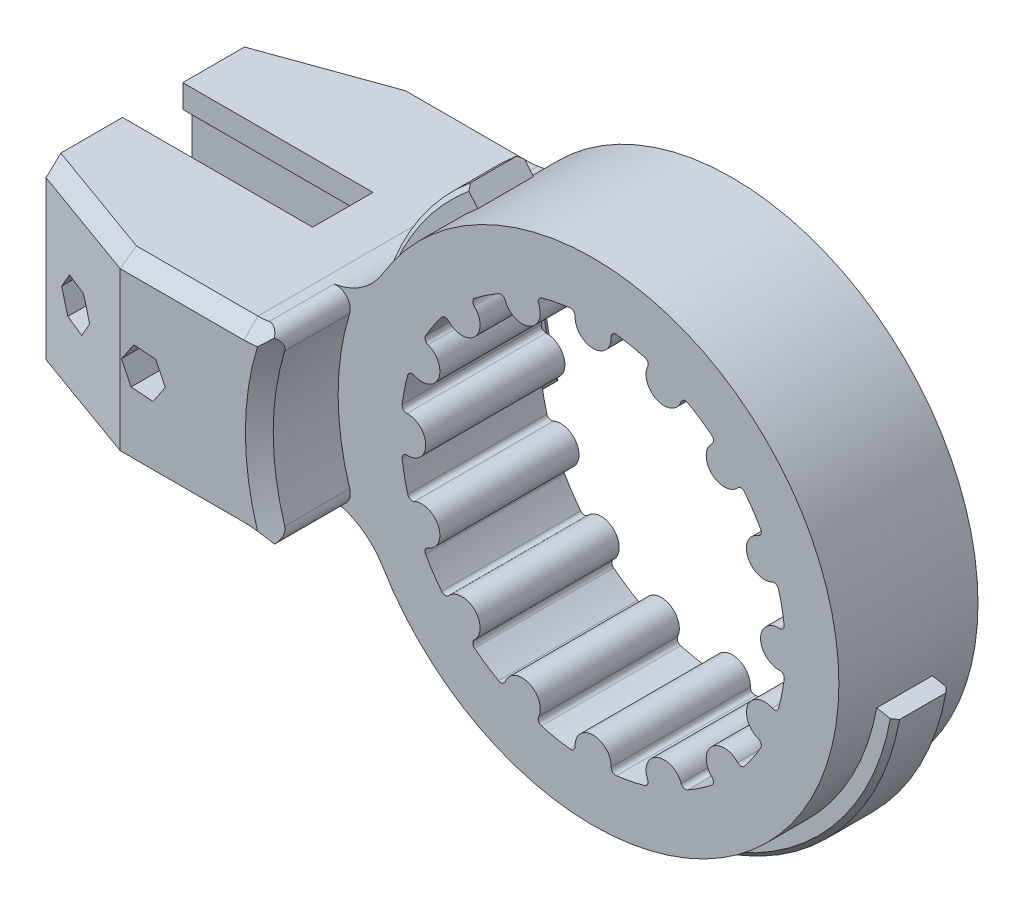
from build123d import *

# Parameters (mm, degrees)
SKETCH1_R           = 53
BOSS_EXTRUDE1_DEPTH = 30
BOSS_EXTRUDE2_DEPTH = 30
BOSS_EXTRUDE3_DEPTH = 17
BOSS_EXTRUDE4_START = 17
BOSS_EXTRUDE4_DEPTH = 17
SKETCH7_W           = 82
SKETCH7_H           = 12.999999999999998
CUT_EXTRUDE3_DEPTH  = 141.13564856952
CUT_EXTRUDE4_DEPTH  = 141.13564856952
FILLET3_R           = 15
CUT_EXTRUDE5_DEPTH  = 41
SKETCH11_R          = 2.750000000000008
CUT_EXTRUDE6_DEPTH  = 138.85862323409444
SKETCH12_R          = 4.599999999999999
SKETCH12_R_2        = 4.600000000000013
CUT_EXTRUDE7_DEPTH  = 12
CUT_EXTRUDE8_DEPTH  = 12
CHAMFER1_SIZE       = 3
CHAMFER2_SIZE       = 3
FILLET5_R           = 3
SKETCH25_R          = 57.000000000000014
SKETCH25_R_2        = 53.00000000000001
BOSS_EXTRUDE8_DEPTH = 6
CUT_EXTRUDE12_START = -15
CUT_EXTRUDE12_DEPTH = 15
CHAMFER4_SIZE       = 1
CUT_EXTRUDE13_DEPTH = 133.5066036875144
FILLET6_R           = 1


with BuildPart() as part:
    # Sketch1 → Boss-Extrude1 (new body)
    with BuildSketch(Plane.XY):
        Circle(SKETCH1_R)
    extrude(amount=BOSS_EXTRUDE1_DEPTH)

    # Sketch4 → Boss-Extrude2 (add)
    with BuildSketch(Plane(origin=(0, 0, 0), x_dir=(-1, 0, 0), z_dir=(0, 0, -1))):
        with BuildLine():
            Line((49.081564767232116, -19.999999999999993), (110, -19.999999999999993))
            Line((110, -19.999999999999993), (110, 20.000000000000007))
            Line((110, 20.000000000000007), (49.08156476723211, 20.000000000000007))
            ThreePointArc((49.08156476723211, 20.000000000000007), (53.00000000000001, 8.83e-15), (49.081564767232116, -19.999999999999993))
        make_face()
    extrude(amount=-BOSS_EXTRUDE2_DEPTH)

    # Sketch5 → Boss-Extrude3 (add)
    with BuildSketch(Plane(origin=(0, 0, 0), x_dir=(-1, 0, 0), z_dir=(0, 0, -1))):
        with BuildLine():
            Line((110, -20), (110, 20))
            Line((110, 20), (51.234753829797995, 20))
            ThreePointArc((51.234753829797995, 20), (55, 0), (51.234753829797995, -20))
            Line((51.234753829797995, -20), (110, -20))
        make_face()
    extrude(amount=BOSS_EXTRUDE3_DEPTH)

    # Sketch6 → Boss-Extrude4 (add)
    with BuildSketch(Plane.XY.offset(30).offset(BOSS_EXTRUDE4_START)):
        with BuildLine():
            Line((-110, -20), (-51.234753829797995, -20))
            ThreePointArc((-51.234753829797995, -20), (-54.99999999999999, 6.74e-15), (-51.23475382979798, 20.00000000000001))
            Line((-51.23475382979798, 20.00000000000001), (-110.00000000000001, 20))
            Line((-110.00000000000001, 20), (-110, -20))
        make_face()
    extrude(amount=-BOSS_EXTRUDE4_DEPTH)

    # Sketch7 → Cut-Extrude3 (cut, through all)
    with BuildSketch(Plane(origin=(0, 20.000000000000007, 0), x_dir=(1, -1.3e-16, 0), z_dir=(1.3e-16, 1, 0))):
        with Locations((-110, -15)):
            Rectangle(SKETCH7_W, SKETCH7_H)
    extrude(amount=-CUT_EXTRUDE3_DEPTH, mode=Mode.SUBTRACT)

    # Sketch8 → Cut-Extrude4 (cut, through all)
    with BuildSketch(Plane(origin=(0, 20.000000000000007, 0), x_dir=(1, -1.3e-16, 0), z_dir=(1.3e-16, 1, 0))):
        Polygon((-110, 7.999999999999993), (-84.99999999999999, 16.999999999999996), (-110, 17), align=None)
        Polygon((-110.00000000000001, -38), (-85.00000000000001, -47), (-110.00000000000001, -47), align=None)
    extrude(amount=-CUT_EXTRUDE4_DEPTH, mode=Mode.SUBTRACT)

    # Fillet3
    # the kernel refuses this fillet: 15 mm, written as the material it adds along each edge
    with BuildSketch(Plane(origin=(-49.0815647672321, 20.000000000000014, -23.048446553404), x_dir=(0.4473529357802653, 0.8943575072915626, 0), z_dir=(0, 0, 1))) as fillet3_piece_1_section:
        with BuildLine():
            CenterArc((9.291046517037513, 14.955714519282), FILLET3_R, 206.57397747208606, 59.02220221936807)
            Line((-4.1243160923359525, 8.245420482578071), (0, 0))
            ThreePointArc((0, 0), (4.0696319454792445, 0.15647536520358749), (8.139263890958485, 1e-16))
        make_face()
    fillet3_piece_1 = extrude(amount=53.048446553404, mode=Mode.PRIVATE)
    fillet3_piece_1 = split(fillet3_piece_1, bisect_by=Plane(origin=(-53.28116974823122, 20.422092874134577, 0), z_dir=(0, 0, -1)), keep=Keep.TOP, mode=Mode.PRIVATE)
    fillet3_piece_1 = split(fillet3_piece_1, bisect_by=Plane(origin=(-53.28116974823122, 20.422092874134577, -17), z_dir=(0, 0, 1)), keep=Keep.TOP, mode=Mode.PRIVATE)
    fillet3_piece_1 = fillet3_piece_1 - Plane(origin=(-4.619e-14, -8.9e-16, -8.500000000001432), x_dir=(-0.9315409787235998, 0.36363636363636387, 0), z_dir=(0, 0, 1)) * Cylinder(54.999999999999964, 140, mode=Mode.PRIVATE)
    add(fillet3_piece_1)
    with BuildSketch(Plane(origin=(-49.0815647672321, 20.000000000000004, 0), x_dir=(0.4473529357802649, 0.8943575072915632, 0), z_dir=(0, 0, 1))) as fillet3_piece_2_section:
        with BuildLine():
            CenterArc((9.291046517037534, 14.955714519282003), FILLET3_R, 206.57397747208603, 59.02220221936807)
            Line((-4.124316092335939, 8.245420482578082), (0, 0))
            ThreePointArc((0, 0), (4.069631945479255, 0.15647536520358993), (8.139263890958498, -1.8e-16))
        make_face()
    fillet3_piece_2 = extrude(amount=30, mode=Mode.PRIVATE)
    fillet3_piece_2 = fillet3_piece_2 & Plane(origin=(-4.619e-14, -8.9e-16, 15.000000000000005), x_dir=(-0.9315409787235998, 0.36363636363636387, 0), z_dir=(0, 0, 1)) * Cylinder(54.999999999999964, 93, mode=Mode.PRIVATE)
    add(fillet3_piece_2)
    with BuildSketch(Plane(origin=(-49.0815647672321, 20.000000000000004, 0), x_dir=(0.4473529357802649, 0.8943575072915632, 0), z_dir=(0, 0, 1))) as fillet3_piece_3_section:
        with BuildLine():
            CenterArc((9.291046517037534, 14.955714519282003), FILLET3_R, 206.57397747208603, 59.02220221936807)
            Line((-4.124316092335939, 8.245420482578082), (0, 0))
            ThreePointArc((0, 0), (4.069631945479255, 0.15647536520358993), (8.139263890958498, -1.8e-16))
        make_face()
    fillet3_piece_3 = extrude(amount=30, mode=Mode.PRIVATE)
    fillet3_piece_3 = fillet3_piece_3 - Plane(origin=(-4.619e-14, -8.9e-16, 15), x_dir=(-0.9315409787235998, 0.36363636363636387, 0), z_dir=(0, 0, 1)) * Cylinder(54.999999999999964, 93, mode=Mode.PRIVATE)
    add(fillet3_piece_3)
    with BuildSketch(Plane(origin=(-49.0815647672321, 20.000000000000004, 0), x_dir=(0.4473529357802649, 0.8943575072915632, 0), z_dir=(0, 0, 1))) as fillet3_piece_4_section:
        with BuildLine():
            CenterArc((9.291046517037534, 14.955714519282003), FILLET3_R, 206.57397747208603, 59.02220221936807)
            Line((-4.124316092335939, 8.245420482578082), (0, 0))
            ThreePointArc((0, 0), (4.069631945479255, 0.15647536520358993), (8.139263890958498, -1.8e-16))
        make_face()
    fillet3_piece_4 = extrude(amount=53.04844655340399, mode=Mode.PRIVATE)
    fillet3_piece_4 = split(fillet3_piece_4, bisect_by=Plane(origin=(-53.28116974823098, 20.422092874134677, 30), z_dir=(0, 0, 1)), keep=Keep.TOP, mode=Mode.PRIVATE)
    fillet3_piece_4 = split(fillet3_piece_4, bisect_by=Plane(origin=(-53.28116974823098, 20.422092874134677, 47), z_dir=(0, 0, -1)), keep=Keep.TOP, mode=Mode.PRIVATE)
    fillet3_piece_4 = fillet3_piece_4 - Plane(origin=(-4.619e-14, -8.9e-16, 38.5), x_dir=(-0.9315409787235998, 0.36363636363636387, 0), z_dir=(0, 0, 1)) * Cylinder(54.999999999999964, 140, mode=Mode.PRIVATE)
    add(fillet3_piece_4)
    with BuildSketch(Plane(origin=(-49.0815647672321, -20, -23.048446553404016), x_dir=(0.44735293578026375, -0.8943575072915635, 0), z_dir=(0, 0, 1))) as fillet3_piece_5_section:
        with BuildLine():
            CenterArc((9.291046517037518, -14.955714519281996), FILLET3_R, 94.40382030854599, 59.022202219367955)
            Line((-4.12431609233595, -8.245420482578071), (0, 0))
            ThreePointArc((0, 0), (4.06963194547922, -0.15647536520359132), (8.139263890958468, 4.4e-16))
        make_face()
    fillet3_piece_5 = extrude(amount=53.04844655340402, mode=Mode.PRIVATE)
    fillet3_piece_5 = split(fillet3_piece_5, bisect_by=Plane(origin=(-53.281169748231235, -20.422092874134563, 0), z_dir=(0, 0, -1)), keep=Keep.TOP, mode=Mode.PRIVATE)
    fillet3_piece_5 = fillet3_piece_5 - Plane(origin=(-4.619e-14, -8.9e-16, -8.50000000000143), x_dir=(-0.9315409787235998, 0.36363636363636387, 0), z_dir=(0, 0, 1)) * Cylinder(54.999999999999964, 140, mode=Mode.PRIVATE)
    fillet3_piece_5 = split(fillet3_piece_5, bisect_by=Plane(origin=(-53.281169748231235, -20.422092874134563, -17), z_dir=(0, 0, 1)), keep=Keep.TOP, mode=Mode.PRIVATE)
    add(fillet3_piece_5)
    with BuildSketch(Plane(origin=(-49.08156476723211, -19.999999999999993, 0), x_dir=(0.44735293578026414, -0.8943575072915634, 0), z_dir=(0, 0, 1))) as fillet3_piece_6_section:
        with BuildLine():
            CenterArc((9.291046517037522, -14.955714519281997), FILLET3_R, 94.40382030854596, 59.02220221936801)
            Line((-4.124316092335951, -8.24542048257808), (0, 0))
            ThreePointArc((0, 0), (4.069631945479229, -0.15647536520358973), (8.139263890958478, 2.1e-16))
        make_face()
    fillet3_piece_6 = extrude(amount=30, mode=Mode.PRIVATE)
    fillet3_piece_6 = fillet3_piece_6 & Plane(origin=(-4.619e-14, -8.9e-16, 15.000000000000002), x_dir=(-0.9315409787235998, 0.36363636363636387, 0), z_dir=(0, 0, 1)) * Cylinder(54.999999999999964, 93, mode=Mode.PRIVATE)
    add(fillet3_piece_6)
    with BuildSketch(Plane(origin=(-49.08156476723211, -19.999999999999993, 0), x_dir=(0.44735293578026414, -0.8943575072915634, 0), z_dir=(0, 0, 1))) as fillet3_piece_7_section:
        with BuildLine():
            CenterArc((9.291046517037522, -14.955714519281997), FILLET3_R, 94.40382030854596, 59.02220221936801)
            Line((-4.124316092335951, -8.24542048257808), (0, 0))
            ThreePointArc((0, 0), (4.069631945479229, -0.15647536520358973), (8.139263890958478, 2.1e-16))
        make_face()
    fillet3_piece_7 = extrude(amount=30, mode=Mode.PRIVATE)
    fillet3_piece_7 = fillet3_piece_7 - Plane(origin=(-4.619e-14, -8.9e-16, 15.000000000000004), x_dir=(-0.9315409787235998, 0.36363636363636387, 0), z_dir=(0, 0, 1)) * Cylinder(54.999999999999964, 93, mode=Mode.PRIVATE)
    add(fillet3_piece_7)
    with BuildSketch(Plane(origin=(-49.08156476723211, -19.999999999999993, 0), x_dir=(0.44735293578026414, -0.8943575072915634, 0), z_dir=(0, 0, 1))) as fillet3_piece_8_section:
        with BuildLine():
            CenterArc((9.291046517037522, -14.955714519281997), FILLET3_R, 94.40382030854596, 59.02220221936801)
            Line((-4.124316092335951, -8.24542048257808), (0, 0))
            ThreePointArc((0, 0), (4.069631945479229, -0.15647536520358973), (8.139263890958478, 2.1e-16))
        make_face()
    fillet3_piece_8 = extrude(amount=53.04844655340402, mode=Mode.PRIVATE)
    fillet3_piece_8 = split(fillet3_piece_8, bisect_by=Plane(origin=(-53.281169748231, -20.422092874134673, 30), z_dir=(0, 0, 1)), keep=Keep.TOP, mode=Mode.PRIVATE)
    fillet3_piece_8 = fillet3_piece_8 - Plane(origin=(-4.619e-14, -8.9e-16, 38.50000000000001), x_dir=(-0.9315409787235998, 0.36363636363636387, 0), z_dir=(0, 0, 1)) * Cylinder(54.999999999999964, 140, mode=Mode.PRIVATE)
    fillet3_piece_8 = split(fillet3_piece_8, bisect_by=Plane(origin=(-53.281169748231, -20.422092874134673, 47), z_dir=(0, 0, -1)), keep=Keep.TOP, mode=Mode.PRIVATE)
    add(fillet3_piece_8)

    # Sketch10 → Cut-Extrude5 (cut)
    with BuildSketch(Plane.ZY.offset(110)):
        Polygon((6.500000000000009, 15.000000000000007), (23.499999999999993, 15.000000000000005), (23.499999999999993, -14.999999999999998), (6.500000000000009, -14.999999999999995), align=None)
    extrude(amount=-CUT_EXTRUDE5_DEPTH, mode=Mode.SUBTRACT)

    # Sketch11 → Cut-Extrude6 (cut, through all)
    with BuildSketch(Plane(origin=(0, 0, -17), x_dir=(-1, 0, 0), z_dir=(0, 0, -1))):
        with Locations((100.00000000000001, -3.67e-15)):
            Circle(SKETCH11_R)
        with Locations((80.00000000000001, -6.12e-15)):
            Circle(SKETCH11_R)
    extrude(amount=-CUT_EXTRUDE6_DEPTH, mode=Mode.SUBTRACT)

    # Sketch12 → Cut-Extrude7 (cut)
    with BuildSketch(Plane(origin=(0, 0, -17), x_dir=(-1, 0, 0), z_dir=(0, 0, -1))):
        with Locations((80.00000000000001, -6.12e-15)):
            Circle(SKETCH12_R)
        with Locations((100.00000000000001, -3.67e-15)):
            Circle(SKETCH12_R_2)
    extrude(amount=-CUT_EXTRUDE7_DEPTH, mode=Mode.SUBTRACT)

    # Sketch13 → Cut-Extrude8 (cut)
    with BuildSketch(Plane.XY.offset(47)):
        Polygon((-104.72243583501142, 0.3345640708945011), (-102.6509589020939, -3.9224673654145996), (-97.92852306708248, -4.25703143630911), (-95.2775641649886, -0.33456407089451756), (-97.34904109790612, 3.922467365414598), (-102.07147693291755, 4.257031436309093), align=None)
        Polygon((-84.72243583501141, 0.3345640708945193), (-82.6509589020939, -3.9224673654145708), (-77.92852306708252, -4.257031436309093), (-75.27756416498863, -0.3345640708945236), (-77.34904109790615, 3.922467365414575), (-82.07147693291752, 4.257031436309095), align=None)
    extrude(amount=-CUT_EXTRUDE8_DEPTH, mode=Mode.SUBTRACT)

    # Chamfer1
    chamfer1_edges = [part.edges().sort_by_distance(p)[0] for p in [
        (-54.113874478650175, 20.596234730340946, 47),
        (-54.11387447865018, -20.596234730340946, 47),
        (-55, 1.066e-14, 47),
        (-71.65047169429675, -20, 47),
        (-97.5, -19.999999999999993, 42.5),
        (-97.50000000000001, 20.00000000000002, 42.5),
        (-71.65047169429675, 20.000000000000007, 47),
    ]]
    chamfer(chamfer1_edges, length=CHAMFER1_SIZE)

    # Chamfer2
    chamfer2_edges = [part.edges().sort_by_distance(p)[0] for p in [
        (-54.11387447865018, -20.596234730340946, -17),
        (-55.000000000000014, 1.688e-14, -17),
        (-71.65047169429673, 20, -17),
        (-97.49999999999999, -19.999999999999993, -12.499999999999995),
        (-97.5, 20.00000000000002, -12.499999999999995),
        (-71.65047169429673, -20, -17),
        (-54.113874478650175, 20.596234730340946, -17),
    ]]
    chamfer(chamfer2_edges, length=CHAMFER2_SIZE)

    # Fillet5
    fillet5_edges = [part.edges().sort_by_distance(p)[0] for p in [
        (-50.25966902236701, -22.33753947421521, -7),
        (-50.25966902236701, -22.33753947421521, 37),
        (-50.25966902236701, 22.33753947421521, -7),
        (-50.25966902236701, 22.33753947421521, 37),
    ]]
    fillet(fillet5_edges, radius=FILLET5_R)

    # Sketch25 → Boss-Extrude8 (add, symmetric)
    with BuildSketch(Plane.XY.offset(15)):
        Circle(SKETCH25_R)
        Circle(SKETCH25_R_2, mode=Mode.SUBTRACT)
    extrude(amount=BOSS_EXTRUDE8_DEPTH, both=True)

    # Sketch26 → Cut-Extrude12 (cut)
    with BuildSketch(Plane.XY.offset(20.999999999999996).offset(CUT_EXTRUDE12_START)):
        with BuildLine():
            Line((56.08608475584366, -10.16617414568147), (52.15021915894235, -9.452758416159961))
            ThreePointArc((52.15021915894235, -9.452758416159961), (26.71911276094378, 45.77214232770815), (-33.873269606877095, 40.76274777465102))
            Line((-33.873269606877095, 40.76274777465102), (-36.429742784754616, 43.83918156896431))
            ThreePointArc((-36.429742784754616, 43.83918156896431), (28.735649573090477, 49.22664363545971), (56.08608475584366, -10.16617414568147))
        make_face()
    extrude(amount=CUT_EXTRUDE12_DEPTH, mode=Mode.SUBTRACT)

    # Chamfer4
    chamfer4_edges = [part.edges().sort_by_distance(p)[0] for p in [
        (5.61573401269491, -56.72268974139594, 21),
        (5.615734012695087, -56.72268974139592, 9),
        (-46.15606788175347, 33.445738109585335, 9),
        (-46.15606788175364, 33.44573810958507, 21),
    ]]
    chamfer(chamfer4_edges, length=CHAMFER4_SIZE)

    # Sketch27 → Cut-Extrude13 (cut, through all)
    with BuildSketch(Plane.XY.offset(30)):
        with BuildLine():
            ThreePointArc((-41.33799999999999, -3.6632985136349734), (-36.09999999999998, 0), (-41.33799999999999, 3.6632985136349734))
            ThreePointArc((-41.33799999999999, 3.6632985136349734), (-40.70258913673405, 8.096248363669334), (-39.59321576392731, 12.43492120888174))
            ThreePointArc((-39.59321576392731, 12.43492120888174), (-33.352051123657425, 13.814871908379772), (-36.78944846597579, 19.203814245334485))
            ThreePointArc((-36.78944846597579, 19.203814245334485), (-34.505988910555594, 23.056164670313528), (-31.820723341191343, 26.64003690018766))
            ThreePointArc((-31.820723341191343, 26.64003690018766), (-25.526554800835093, 25.526554800833708), (-26.640036900188544, 31.820723341190607))
            ThreePointArc((-26.640036900188544, 31.820723341190607), (-23.05616467031391, 34.505988910555345), (-19.203814245334275, 36.789448465975894))
            ThreePointArc((-19.203814245334275, 36.789448465975894), (-13.814871908380718, 33.352051123656665), (-12.434921208883269, 39.59321576392684))
            ThreePointArc((-12.434921208883269, 39.59321576392684), (-8.096248363670052, 40.70258913673391), (-3.663298513634829, 41.338))
            ThreePointArc((-3.663298513634829, 41.338), (-1.12863e-12, 36.09999999999883), (3.6632985136331393, 41.338000000000164))
            ThreePointArc((3.6632985136331393, 41.338000000000164), (8.096248363668556, 40.70258913673421), (12.434921208881963, 39.59321576392725))
            ThreePointArc((12.434921208881963, 39.59321576392725), (13.814871908378183, 33.35205112365597), (19.20381424533285, 36.78944846597663))
            ThreePointArc((19.20381424533285, 36.78944846597663), (23.056164670312832, 34.505988910556056), (26.64003690018777, 31.820723341191243))
            ThreePointArc((26.64003690018777, 31.820723341191243), (25.526554800832038, 25.526554800832546), (31.820723341190405, 26.640036900188786))
            ThreePointArc((31.820723341190405, 26.640036900188786), (34.50598891055528, 23.05616467031398), (36.78944846597595, 19.203814245334144))
            ThreePointArc((36.78944846597595, 19.203814245334144), (33.35205112365423, 13.814871908378157), (39.59321576392702, 12.434921208882718))
            ThreePointArc((39.59321576392702, 12.434921208882718), (40.70258913673413, 8.096248363668986), (41.33800000000015, 3.663298513633235))
            ThreePointArc((41.33800000000015, 3.663298513633235), (36.09999999999716, -3.912e-13), (41.33799999999996, -3.6632985136352625))
            ThreePointArc((41.33799999999996, -3.6632985136352625), (40.70258913673382, -8.096248363670547), (39.59321576392667, -12.434921208883813))
            ThreePointArc((39.59321576392667, -12.434921208883813), (33.35205112365465, -13.81487190837967), (36.78944846597569, -19.203814245334666))
            ThreePointArc((36.78944846597569, -19.203814245334666), (34.50598891055488, -23.056164670314615), (31.820723341189822, -26.64003690018949))
            ThreePointArc((31.820723341189822, -26.64003690018949), (25.526554800831782, -25.52655480083383), (26.640036900187322, -31.82072334119162))
            ThreePointArc((26.640036900187322, -31.82072334119162), (23.05616467031232, -34.50598891055641), (19.203814245332282, -36.78944846597694))
            ThreePointArc((19.203814245332282, -36.78944846597694), (13.814871908377526, -33.352051123656544), (12.43492120888131, -39.593215763927454))
            ThreePointArc((12.43492120888131, -39.593215763927454), (8.096248363668016, -40.702589136734325), (3.6632985136327427, -41.33800000000019))
            ThreePointArc((3.6632985136327427, -41.33800000000019), (-1.75086e-12, -36.09999999999889), (-3.6632985136354064, -41.33799999999996))
            ThreePointArc((-3.6632985136354064, -41.33799999999996), (-8.096248363670433, -40.70258913673385), (-12.434921208883452, -39.59321576392679))
            ThreePointArc((-12.434921208883452, -39.59321576392679), (-13.814871908380951, -33.35205112365632), (-19.203814245334854, -36.7894484659756))
            ThreePointArc((-19.203814245334854, -36.7894484659756), (-23.05616467031393, -34.50598891055534), (-26.64003690018806, -31.82072334119101))
            ThreePointArc((-26.64003690018806, -31.82072334119101), (-25.52655480083471, -25.526554800834095), (-31.820723341191652, -26.640036900187287))
            ThreePointArc((-31.820723341191652, -26.640036900187287), (-34.505988910555885, -23.05616467031308), (-36.78944846597605, -19.20381424533395))
            ThreePointArc((-36.78944846597605, -19.20381424533395), (-33.352051123657624, -13.814871908379276), (-39.59321576392749, -12.434921208881171))
            ThreePointArc((-39.59321576392749, -12.434921208881171), (-40.702589136734105, -8.096248363669046), (-41.33799999999999, -3.6632985136349734))
        make_face()
    extrude(amount=-CUT_EXTRUDE13_DEPTH, mode=Mode.SUBTRACT)

    # Fillet6
    fillet6_edges = [part.edges().sort_by_distance(p)[0] for p in [
        (-39.593215763927496, -12.43492120888117, 15),
        (-41.33799999999999, -3.6632985136349725, 15),
        (-41.33799999999999, 3.663298513634974, 15),
        (-39.593215763927304, 12.43492120888174, 15),
        (-36.78944846597579, 19.203814245334485, 15),
        (-31.820723341191346, 26.64003690018766, 15),
        (-26.640036900188548, 31.820723341190607, 15),
        (-19.20381424533428, 36.7894484659759, 15),
        (-12.43492120888327, 39.593215763926835, 15),
        (-3.6632985136348264, 41.338, 15),
        (3.6632985136331393, 41.338000000000164, 15),
        (12.434921208881963, 39.59321576392725, 15),
        (19.20381424533285, 36.78944846597663, 15),
        (26.64003690018777, 31.820723341191247, 15),
        (31.820723341190405, 26.64003690018879, 15),
        (36.78944846597595, 19.203814245334144, 15),
        (39.59321576392702, 12.434921208882717, 15),
        (41.33800000000015, 3.663298513633237, 15),
        (41.337999999999965, -3.6632985136352625, 15),
        (39.59321576392668, -12.434921208883814, 15),
        (36.78944846597569, -19.20381424533467, 15),
        (31.820723341189826, -26.640036900189493, 15),
        (26.640036900187326, -31.820723341191616, 15),
        (19.203814245332282, -36.789448465976946, 15),
        (12.43492120888131, -39.59321576392746, 15),
        (3.663298513632742, -41.3380000000002, 15),
        (-3.663298513635409, -41.337999999999965, 15),
        (-12.434921208883456, -39.5932157639268, 15),
        (-19.203814245334854, -36.7894484659756, 15),
        (-26.640036900188058, -31.82072334119101, 15),
        (-31.820723341191652, -26.640036900187287, 15),
        (-36.78944846597605, -19.203814245333948, 15),
    ]]
    fillet(fillet6_edges, radius=FILLET6_R)


solid = part.part
